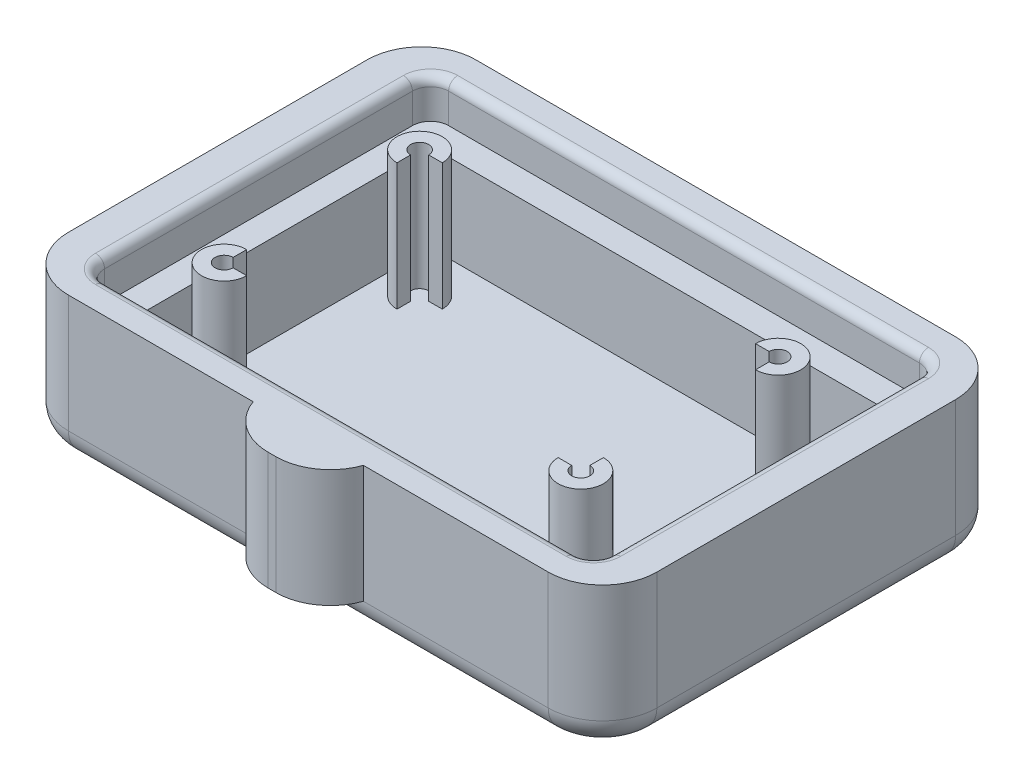
from build123d import *

# Parameters (mm, degrees)
SKETCH1_W               = 82.55
SKETCH1_H               = 57.15
BOSS_EXTRUDE1_DEPTH     = 20.32
FILLET2_R               = 7.62
FILLET3_R               = 3.81
SKETCH2_W               = 63.5
SKETCH2_H               = 40.64
CUT_EXTRUDE1_DEPTH      = 17.78
SKETCH9_W               = 15.46152766
SKETCH9_H               = 16.51
BOSS_EXTRUDE5_DEPTH     = 5.08
FILLET10_R              = 7.62
SKETCH7_W               = 71.12
SKETCH7_H               = 48.26
CUT_EXTRUDE4_DEPTH      = 5.461
FILLET12_R              = 2.54
FILLET13_R              = 1.27
SKETCH5_R               = 3.175
BOSS_EXTRUDE6_DEPTH     = 17.78
SKETCH11_R              = 1.27
CUT_EXTRUDE5_DEPTH      = 17.78
CUT_EXTRUDE_THIN1_DEPTH = 102.964471319


with BuildPart() as part:
    # Sketch1 → Boss-Extrude1 (new body)
    with BuildSketch(Plane(origin=(0, 0, 0), x_dir=(1, 0, 0), z_dir=(0, 1, 0))):
        with Locations((41.275, 28.575)):
            Rectangle(SKETCH1_W, SKETCH1_H)
    extrude(amount=BOSS_EXTRUDE1_DEPTH)

    # Fillet2
    fillet2_edges = [part.edges().sort_by_distance(p)[0] for p in [
        (0, 10.16, -57.15),
        (82.55, 10.16, -57.15),
        (82.55, 10.16, 0),
        (0, 10.16, 0),
    ]]
    fillet(fillet2_edges, radius=FILLET2_R)

    # Fillet3
    fillet3_edges = [part.edges().sort_by_distance(p)[0] for p in [
        (41.275, 0, -57.15),
        (0, 0, -28.575),
        (82.55, 0, -28.575),
        (41.275, 0, 0),
        (2.231846327, 0, -54.918153673),
        (2.231846327, 0, -2.231846327),
        (80.318153673, 0, -2.231846327),
        (80.318153673, 0, -54.918153673),
    ]]
    fillet(fillet3_edges, radius=FILLET3_R)

    # Sketch2 → Cut-Extrude1 (cut)
    with BuildSketch(Plane(origin=(0, 20.32, 0), x_dir=(1, 0, 0), z_dir=(0, 1, 0))):
        with Locations((41.275, 28.575)):
            Rectangle(SKETCH2_W, SKETCH2_H)
    extrude(amount=-CUT_EXTRUDE1_DEPTH, mode=Mode.SUBTRACT)

    # Sketch9 → Boss-Extrude5 (add)
    with BuildSketch(Plane.XY):
        with Locations((41.275, 12.065)):
            Rectangle(SKETCH9_W, SKETCH9_H)
    extrude(amount=BOSS_EXTRUDE5_DEPTH)

    # Fillet10
    # the kernel refuses this fillet: 7.62 mm, written as the material it takes off along each edge
    with BuildSketch(Plane(origin=(49.00576383, -14.150512242, 5.08), x_dir=(-1, 0, 0), z_dir=(0, 1, 0))) as fillet10_piece_1:
        with BuildLine():
            CenterArc((7.184204897, -7.62), FILLET10_R, 90, 70.528779366)
            Line((0, -5.08), (-0.143684098, -5.0292))
            ThreePointArc((-0.143684098, -5.0292), (-0.1524, -2.54), (-0.1524, 0))
            Line((-0.1524, 0), (0, 0.1524))
            Line((0, 0.1524), (7.184204897, 0.1524))
            Line((7.184204897, 0.1524), (7.184204897, 0))
        make_face()
    extrude(amount=52.431024484, mode=Mode.SUBTRACT)
    with BuildSketch(Plane(origin=(33.54423617, 38.280512242, 5.08), x_dir=(0, 0, -1), z_dir=(0, -1, 0))) as fillet10_piece_2:
        with BuildLine():
            CenterArc((7.62, 7.184204897), FILLET10_R, 180, 70.528779366)
            Line((0, 7.184204897), (-0.1524, 7.184204897))
            Line((-0.1524, 7.184204897), (-0.1524, 0))
            Line((-0.1524, 0), (0, -0.1524))
            ThreePointArc((0, -0.1524), (2.54, -0.1524), (5.0292, -0.143684098))
            Line((5.0292, -0.143684098), (5.08, 0))
        make_face()
    extrude(amount=52.431024484, mode=Mode.SUBTRACT)

    # Sketch7 → Cut-Extrude4 (cut)
    with BuildSketch(Plane(origin=(0, 20.32, 0), x_dir=(1, 0, 0), z_dir=(0, 1, 0))):
        with Locations((41.275, 28.575)):
            Rectangle(SKETCH7_W, SKETCH7_H)
    extrude(amount=-CUT_EXTRUDE4_DEPTH, mode=Mode.SUBTRACT)

    # Fillet12
    fillet12_edges = [part.edges().sort_by_distance(p)[0] for p in [
        (5.715, 17.5895, -52.705),
        (76.835, 17.5895, -52.705),
        (76.835, 17.5895, -4.445),
        (5.715, 17.5895, -4.445),
    ]]
    fillet(fillet12_edges, radius=FILLET12_R)

    # Fillet13
    fillet13_edges = [part.edges().sort_by_distance(p)[0] for p in [
        (41.275, 20.32, -52.705),
        (76.835, 20.32, -28.575),
        (41.275, 20.32, -4.445),
        (5.715, 20.32, -28.575),
        (76.091051224, 20.32, -51.961051224),
        (76.091051224, 20.32, -5.188948776),
        (6.458948776, 20.32, -51.961051224),
        (6.458948776, 20.32, -5.188948776),
    ]]
    fillet(fillet13_edges, radius=FILLET13_R)

    # Sketch5 → Boss-Extrude6 (add)
    with BuildSketch(Plane(origin=(0, 2.54, 0), x_dir=(1, 0, 0), z_dir=(0, 1, 0))):
        with Locations(Location((14.605, 42.291, 0), (0, 0, 90))):
            Circle(SKETCH5_R)
        with Locations(Location((14.605, 14.859, 0), (0, 0, 90))):
            Circle(SKETCH5_R)
        with Locations(Location((64.897, 42.291, 0), (0, 0, 90))):
            Circle(SKETCH5_R)
        with Locations(Location((64.896358582, 14.605, 0), (0, 0, 90))):
            Circle(SKETCH5_R)
    extrude(amount=BOSS_EXTRUDE6_DEPTH)

    # Sketch11 → Cut-Extrude5 (cut)
    with BuildSketch(Plane(origin=(0, 20.32, 0), x_dir=(1, 0, 0), z_dir=(0, 1, 0))):
        with Locations(Location((14.605, 14.859, 0), (0, 0, 270))):
            Circle(SKETCH11_R)
        with Locations(Location((14.605, 42.291, 0), (0, 0, 270))):
            Circle(SKETCH11_R)
        with Locations(Location((64.896358582, 14.605, 0), (0, 0, 270))):
            Circle(SKETCH11_R)
        with Locations(Location((64.897, 42.291, 0), (0, 0, 270))):
            Circle(SKETCH11_R)
    extrude(amount=-CUT_EXTRUDE5_DEPTH, mode=Mode.SUBTRACT)

    # Sketch17 → Cut-Extrude-Thin1 (cut, through all)
    with BuildSketch(Plane(origin=(0, 2.54, 0), x_dir=(1, 0, 0), z_dir=(0, 1, 0))):
        with BuildLine():
            ThreePointArc((18.78, 42.291), (17.557170811, 39.338829189), (14.605, 38.116))
            Line((14.605, 38.116), (14.605, 41.656))
            ThreePointArc((14.605, 41.656), (15.054012806, 41.841987194), (15.24, 42.291))
            Line((15.24, 42.291), (18.78, 42.291))
        make_face()
        with BuildLine():
            ThreePointArc((60.721358582, 14.605), (61.94418777, 17.557170811), (64.896358582, 18.78))
            Line((64.896358582, 18.78), (64.896358582, 15.24))
            ThreePointArc((64.896358582, 15.24), (64.447345776, 15.054012806), (64.261358582, 14.605))
            Line((64.261358582, 14.605), (60.721358582, 14.605))
        make_face()
        with BuildLine():
            ThreePointArc((14.605, 19.034), (17.557170811, 17.811170811), (18.78, 14.859))
            Line((18.78, 14.859), (15.24, 14.859))
            ThreePointArc((15.24, 14.859), (15.054012806, 15.308012806), (14.605, 15.494))
            Line((14.605, 15.494), (14.605, 19.034))
        make_face()
        with BuildLine():
            ThreePointArc((64.627, 42.291), (64.706081169, 42.100081169), (64.897, 42.021))
            Line((64.897, 42.021), (64.897, 38.481))
            ThreePointArc((64.897, 38.481), (62.202923164, 39.596923164), (61.087, 42.291))
            Line((61.087, 42.291), (64.627, 42.291))
        make_face()
    extrude(amount=CUT_EXTRUDE_THIN1_DEPTH, mode=Mode.SUBTRACT)


solid = part.part
